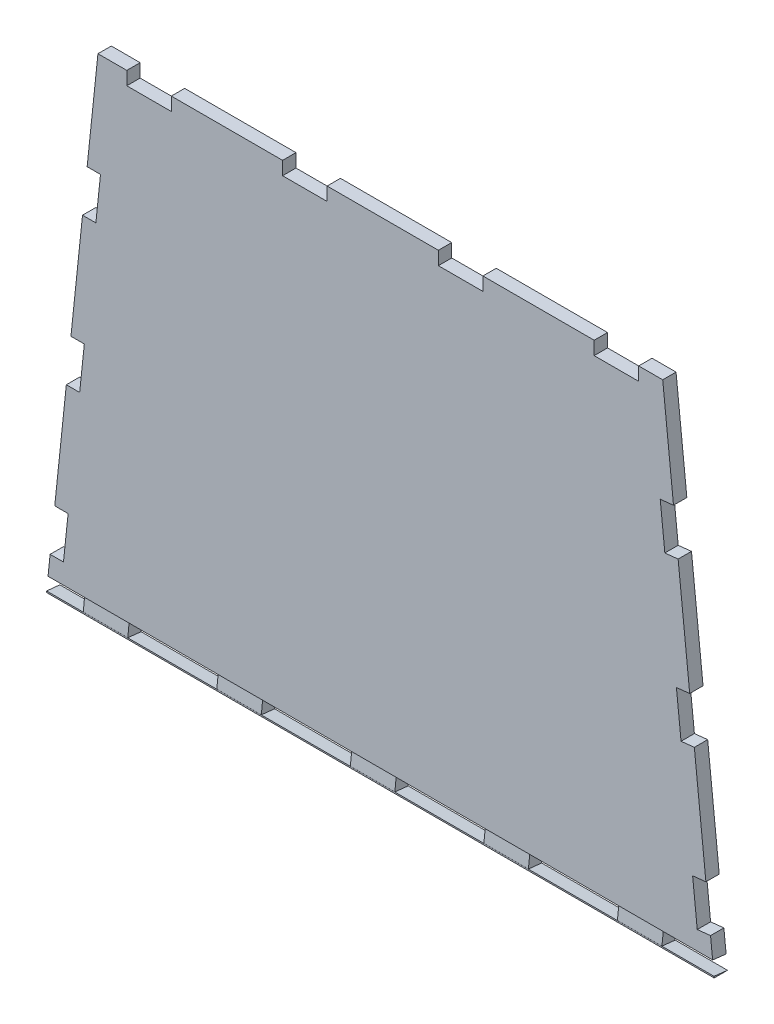
from build123d import *

# Parameters (mm, degrees)
BOSS_EXTRUDE1_DEPTH = 3
CUT_EXTRUDE1_DEPTH  = 128.25921375
LPATTERN1_COUNT     = 4
LPATTERN1_PITCH     = 35
CUT_EXTRUDE3_DEPTH  = 3
LPATTERN2_COUNT     = 3
LPATTERN2_PITCH     = 35
CUT_EXTRUDE4_DEPTH  = 3
LPATTERN3_COUNT     = 3
LPATTERN3_PITCH     = 35
CAVITY1_START       = -7.796688406
CAVITY1_DEPTH       = 3


# Read off the part's stored shape, not the designer's step: Cavity1
with BuildPart() as part:
    # Sketch1 → Boss-Extrude1 (new body)
    with BuildSketch(Plane.XY):
        Polygon((-63.438534121, 102.766276007), (63.438534121, 102.766276007), (75, -7.839634745), (-75, -7.839634745), align=None)
    extrude(amount=BOSS_EXTRUDE1_DEPTH)

    # Sketch2 → Cut-Extrude1 (cut, symmetric)
    with BuildSketch(Plane.XY):
        Polygon((-56.956577019, 457.127747207), (-56.956577019, 102.766276007), (-56.956577019, 99.766276007), (-46.956577019, 99.766276007), (-46.956577019, 102.766276007), (-46.956577019, 457.127747207), (-46.956577019, 1165.850689606), (-56.956577019, 1165.850689606), align=None)
    cut_extrude1 = extrude(amount=CUT_EXTRUDE1_DEPTH, both=True, mode=Mode.SUBTRACT)

    # LPattern1: Cut-Extrude1 ×4
    with Locations(*[(i * LPATTERN1_PITCH, 0, 0) for i in range(1, LPATTERN1_COUNT)]):
        add(cut_extrude1, mode=Mode.SUBTRACT)

    # Sketch3 → Cut-Extrude3 (cut)
    with BuildSketch(Plane.XY.offset(3)):
        Polygon((-74.180535028, 0), (-71.180535028, 0), (-70.140914516, 9.945812646), (-73.140914516, 9.945812646), align=None)
    cut_extrude3 = extrude(amount=-CUT_EXTRUDE3_DEPTH, mode=Mode.SUBTRACT)

    # LPattern2: Cut-Extrude3 ×3
    with Locations(*[Vector(0.10396205118449778, 0.9945812646101434, 0) * (i * LPATTERN2_PITCH) for i in range(1, LPATTERN2_COUNT)]):
        add(cut_extrude3, mode=Mode.SUBTRACT)

    # Sketch7 → Cut-Extrude4 (cut)
    with BuildSketch(Plane.XY.offset(3)):
        Polygon((74.180535028, 0), (73.140914516, 9.945812646), (70.157170722, 9.633926493), (71.196791234, -0.311886154), align=None)
    cut_extrude4 = extrude(amount=-CUT_EXTRUDE4_DEPTH, mode=Mode.SUBTRACT)

    # LPattern3: Cut-Extrude4 ×3
    with Locations(*[Vector(-0.10396205118449776, 0.9945812646101434, 0) * (i * LPATTERN3_PITCH) for i in range(1, LPATTERN3_COUNT)]):
        add(cut_extrude4, mode=Mode.SUBTRACT)

    # Cavity1 outline → Cavity1 (cut)
    with BuildSketch(Plane(origin=(0, 0, 0), x_dir=(1, 0, 0), z_dir=(0, 0.9945218953682734, -0.10452846326765304)).offset(CAVITY1_START)):
        Polygon((-56.749963879, 2), (-56.749963879, -2.180535028), (-66.749963879, -2.180535028), (-66.749963879, 2), (-77, 2), (-77, -4), (77, -4), (77, 2), (63.250036121, 2), (63.250036121, -2.180535028), (53.250036121, -2.180535028), (53.250036121, 2), (33.250036121, 2), (33.250036121, -2.180535028), (23.250036121, -2.180535028), (23.250036121, 2), (3.250036121, 2), (3.250036121, -2.180535028), (-6.749963879, -2.180535028), (-6.749963879, 2), (-26.749963879, 2), (-26.749963879, -2.180535028), (-36.749963879, -2.180535028), (-36.749963879, 2), align=None)
    extrude(amount=CAVITY1_DEPTH, mode=Mode.SUBTRACT)


solid = part.part
